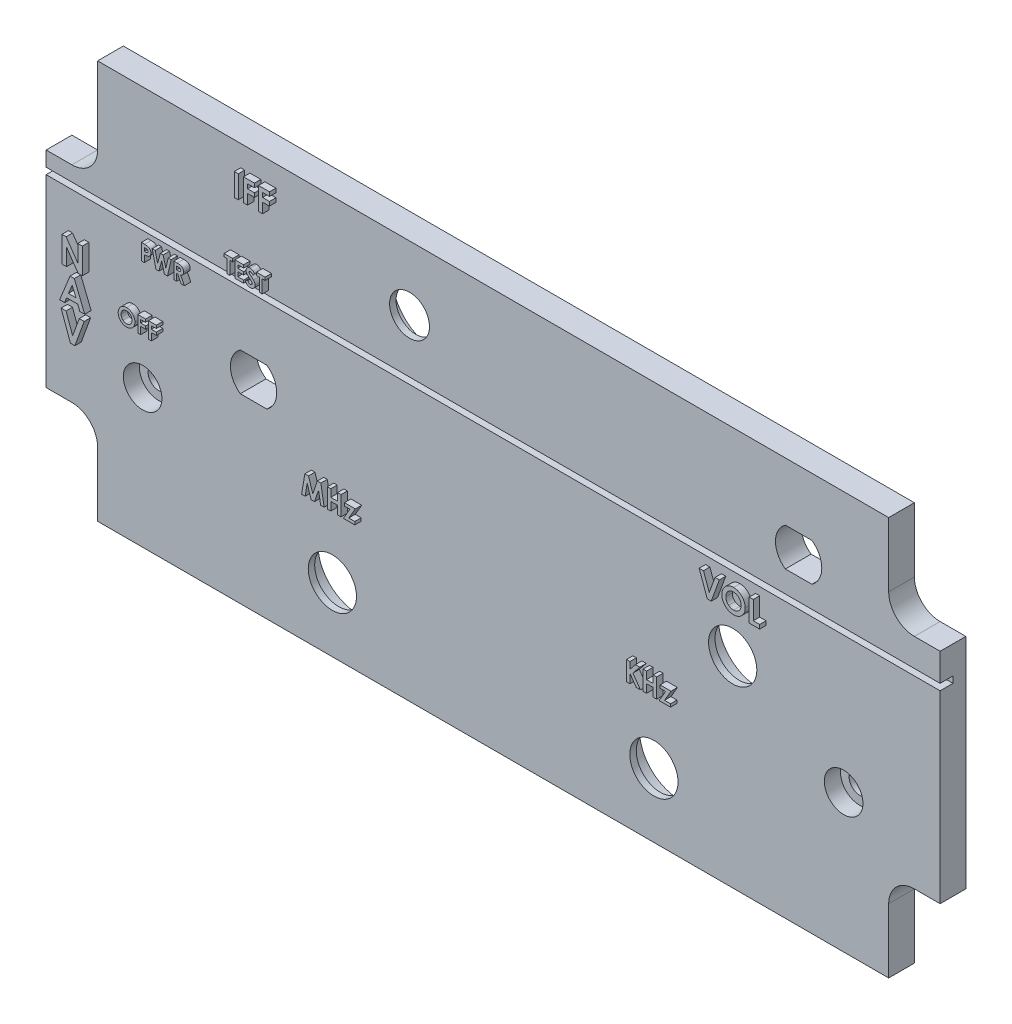
from build123d import *

# Parameters (mm, degrees)
SKETCH1_R           = 1.65
SKETCH1_R_2         = 3.75
SKETCH1_R_3         = 3.1
BOSS_EXTRUDE1_DEPTH = 4
SKETCH2_R           = 6.25
SKETCH2_R_2         = 3.75
SKETCH2_R_3         = 6.75
SKETCH2_R_4         = 3.1
BACK_HOLES_DEPTH    = 3
SKETCH3_R           = 3
CUT_EXTRUDE2_DEPTH  = 2.5
SKETCH5_W           = 139
SKETCH5_H           = 1
CUT_EXTRUDE3_DEPTH  = 2
SKETCH4_W           = 0.628205128
SKETCH4_H           = 3.5
TEXTOS_DEPTH        = 1


with BuildPart() as part:
    # Sketch1 → Boss-Extrude1 (new body)
    with BuildSketch(Plane.XY):
        with BuildLine():
            Line((8, 0), (131, 0))
            Line((131, 0), (131, 10))
            ThreePointArc((131, 10), (132.171572875, 12.828427125), (135, 14))
            Line((135, 14), (139, 14))
            Line((139, 14), (139, 48))
            Line((139, 48), (135, 48))
            ThreePointArc((135, 48), (132.171572875, 49.171572875), (131, 52))
            Line((131, 52), (131, 62))
            Line((131, 62), (8, 62))
            Line((8, 62), (8, 50))
            ThreePointArc((8, 50), (6.828427125, 47.171572875), (4, 46))
            Line((4, 46), (0, 46))
            Line((0, 46), (0, 14))
            Line((0, 14), (4, 14))
            ThreePointArc((4, 14), (6.828427125, 12.828427125), (8, 10))
            Line((8, 10), (8, 0))
        make_face()
        with Locations((15, 21.5)):
            Circle(SKETCH1_R, mode=Mode.SUBTRACT)
        with Locations((124, 21.5)):
            Circle(SKETCH1_R, mode=Mode.SUBTRACT)
        with Locations((106.75, 31.217622393)):
            Circle(SKETCH1_R_2, mode=Mode.SUBTRACT)
        with Locations((94.5, 10)):
            Circle(SKETCH1_R_2, mode=Mode.SUBTRACT)
        with Locations((44.5, 10)):
            Circle(SKETCH1_R_2, mode=Mode.SUBTRACT)
        with Locations((56.5, 52)):
            Circle(SKETCH1_R_3, mode=Mode.SUBTRACT)
        with BuildLine():
            Line((30.186628972, 28.267622393), (34.313371028, 28.267622393))
            ThreePointArc((34.313371028, 28.267622393), (35.85, 31.217622393), (34.313371028, 34.167622393))
            Line((34.313371028, 34.167622393), (30.186628972, 34.167622393))
            ThreePointArc((30.186628972, 34.167622393), (28.65, 31.217622393), (30.186628972, 28.267622393))
        make_face(mode=Mode.SUBTRACT)
        with BuildLine():
            Line((114.936628972, 47.05), (119.063371028, 47.05))
            ThreePointArc((119.063371028, 47.05), (120.6, 50), (119.063371028, 52.95))
            Line((119.063371028, 52.95), (114.936628972, 52.95))
            ThreePointArc((114.936628972, 52.95), (113.4, 50), (114.936628972, 47.05))
        make_face(mode=Mode.SUBTRACT)
    extrude(amount=BOSS_EXTRUDE1_DEPTH)

    # Sketch2 → Back holes (cut)
    # profile 1 of 4: a face of its own
    with BuildSketch(Plane(origin=(0, 0, 0), x_dir=(-1, 0, 0), z_dir=(0, 0, -1))):
        with Locations((-44.5, 10)):
            Circle(SKETCH2_R)
        with Locations((-44.5, 10)):
            Circle(SKETCH2_R_2, mode=Mode.SUBTRACT)
    # profile 2 of 4: a face of its own
    with BuildSketch(Plane(origin=(0, 0, 0), x_dir=(-1, 0, 0), z_dir=(0, 0, -1))):
        with Locations((-94.5, 10)):
            Circle(SKETCH2_R)
        with Locations((-94.5, 10)):
            Circle(SKETCH2_R_2, mode=Mode.SUBTRACT)
    # profile 3 of 4: a face of its own
    with BuildSketch(Plane(origin=(0, 0, 0), x_dir=(-1, 0, 0), z_dir=(0, 0, -1))):
        with Locations((-106.75, 31.217622393)):
            Circle(SKETCH2_R)
        with Locations((-106.75, 31.217622393)):
            Circle(SKETCH2_R_2, mode=Mode.SUBTRACT)
    # profile 4 of 4: a face of its own
    with BuildSketch(Plane(origin=(0, 0, 0), x_dir=(-1, 0, 0), z_dir=(0, 0, -1))):
        with Locations((-56.5, 52)):
            Circle(SKETCH2_R_3)
        with Locations((-56.5, 52)):
            Circle(SKETCH2_R_4, mode=Mode.SUBTRACT)
    extrude(amount=-BACK_HOLES_DEPTH, mode=Mode.SUBTRACT)

    # Sketch3 → Cut-Extrude2 (cut)
    with BuildSketch(Plane.XY.offset(4)):
        with Locations((15, 21.5)):
            Circle(SKETCH3_R)
        with Locations((124, 21.5)):
            Circle(SKETCH3_R)
    extrude(amount=-CUT_EXTRUDE2_DEPTH, mode=Mode.SUBTRACT)

    # Sketch5 → Cut-Extrude3 (cut)
    with BuildSketch(Plane.XY.offset(4)):
        with Locations((69.5, 43.174651963)):
            Rectangle(SKETCH5_W, SKETCH5_H)
    extrude(amount=-CUT_EXTRUDE3_DEPTH, mode=Mode.SUBTRACT)

    # Sketch4 → Textos (add)
    # profile 1 of 25: a face of its own
    with BuildSketch(Plane.XY.offset(4)):
        Polygon((3.456317208, 36.872484532), (4.102951824, 36.872484532), (5.91785567, 34.240272994), (5.91785567, 36.872484532), (6.635804388, 36.872484532), (6.635804388, 32.872484532), (5.98436208, 32.872484532), (4.174265926, 35.49668325), (4.174265926, 32.872484532), (3.456317208, 32.872484532), align=None)
    # profile 2 of 25: a face of its own
    with BuildSketch(Plane.XY.offset(4)):
        with BuildLine():
            add(Edge.make_bspline(
                [(13.505282568, 32.032467925), (13.548748132, 32.031342524), (13.634559, 32.029120727), (13.760755821, 32.010600314), (13.882369792, 31.980423958), (13.999345918, 31.938476639), (14.111391307, 31.883622212), (14.218901178, 31.817415836), (14.321490437, 31.738607905), (14.418107832, 31.649036877), (14.50739973, 31.551632296), (14.584771211, 31.446758948), (14.650750772, 31.337134205), (14.705434809, 31.222464326), (14.747086881, 31.101955167), (14.776315863, 30.976221165), (14.795094036, 30.845298091), (14.797253815, 30.756157323), (14.798351479, 30.710853342)],
                knots=[0, 0, 0, 0, 1.014329547, 2.002516266, 2.970391464, 3.935626869, 4.897733899, 5.877609409, 6.878433252, 7.912639331, 8.949961323, 9.958554974, 10.949718813, 11.932905612, 12.9188844, 13.919928257, 14.942845884, 16, 16, 16, 16], degree=3))
            add(Edge.make_bspline(
                [(14.798351479, 30.710853342), (14.797182514, 30.666059832), (14.794879033, 30.577792784), (14.777082471, 30.448076218), (14.747361269, 30.323689089), (14.706415648, 30.204349845), (14.652723373, 30.090636525), (14.588030485, 29.981823084), (14.510629863, 29.878919337), (14.423344609, 29.781980506), (14.32725112, 29.693987717), (14.225472861, 29.616444223), (14.11847978, 29.550736793), (14.006428482, 29.496895523), (13.889078677, 29.455111296), (13.766720235, 29.425629488), (13.639360726, 29.407712798), (13.552750083, 29.405424363), (13.508788177, 29.404262797)],
                knots=[0, 0, 0, 0, 1.051557043, 2.072126891, 3.067553643, 4.050577992, 5.02905126, 6.015227836, 7.017913613, 8.04756643, 9.074058332, 10.072836633, 11.047628519, 12.017157415, 12.98668631, 13.966869689, 14.968021931, 16, 16, 16, 16], degree=3))
            add(Edge.make_bspline(
                [(13.508788177, 29.404262797), (13.462809295, 29.405304779), (13.372467076, 29.407352131), (13.240250834, 29.426821516), (13.11357625, 29.456149212), (12.993507463, 29.499919224), (12.878821675, 29.554635419), (12.770361516, 29.622021694), (12.668163437, 29.701966688), (12.572813661, 29.792422979), (12.486426534, 29.891402002), (12.410172949, 29.995964563), (12.345851359, 30.105311894), (12.293459409, 30.219495175), (12.252155701, 30.337804782), (12.223020628, 30.460961255), (12.205809845, 30.588669222), (12.203412483, 30.675411026), (12.202197633, 30.719366963)],
                knots=[0, 0, 0, 0, 1.067978421, 2.098431617, 3.099715153, 4.085208694, 5.062210972, 6.048429807, 7.046490867, 8.072918869, 9.098532598, 10.095778865, 11.076610158, 12.041847152, 13.011192615, 13.984257998, 14.978533688, 16, 16, 16, 16], degree=3))
            add(Edge.make_bspline(
                [(12.202197633, 30.719366963), (12.202578923, 30.748938217), (12.203336675, 30.807706285), (12.212464595, 30.894797562), (12.225606177, 30.980188934), (12.245041952, 31.063539945), (12.268651452, 31.145438597), (12.299240894, 31.225122557), (12.334059957, 31.303443069), (12.374742754, 31.37947507), (12.419978091, 31.452519002), (12.46933387, 31.522230303), (12.522934198, 31.587766063), (12.580606408, 31.649556956), (12.642549247, 31.707196824), (12.707947922, 31.761501641), (12.778070786, 31.811028879), (12.851383068, 31.85698809), (12.927471453, 31.898548207), (13.00602619, 31.933922936), (13.085428897, 31.964815084), (13.166740287, 31.989196534), (13.249088964, 32.009054969), (13.333354657, 32.022187693), (13.418776072, 32.031315361), (13.476378637, 32.032082825), (13.505282568, 32.032467925)],
                knots=[0, 0, 0, 0, 1.034744296, 2.056386356, 3.06226378, 4.057406941, 5.050368692, 6.043467995, 7.042652155, 8.049140477, 9.059438543, 10.048523776, 11.036952808, 12.020949711, 13.004946614, 13.997082645, 14.994316842, 16.007702937, 17.024872941, 18.026463647, 19.021641123, 20.005082605, 20.995858141, 21.984425357, 22.988620895, 24, 24, 24, 24], degree=3))
        make_face()
        with BuildLine():
            add(Edge.make_bspline(
                [(13.49827135, 31.583749976), (13.469019032, 31.582965071), (13.41128666, 31.581415982), (13.326603785, 31.569614018), (13.245305235, 31.550764939), (13.167841678, 31.52346228), (13.093877383, 31.488712924), (13.023281232, 31.44663829), (12.957030837, 31.395792109), (12.894242813, 31.338904086), (12.837524165, 31.275517755), (12.78741145, 31.207588522), (12.745475179, 31.135229826), (12.710353289, 31.059113864), (12.68391429, 30.978384731), (12.665082584, 30.893674787), (12.653181649, 30.804838074), (12.651681521, 30.744278202), (12.650915581, 30.713357348)],
                knots=[0, 0, 0, 0, 1.033739768, 2.040188636, 3.016340934, 3.979330865, 4.937572243, 5.900995986, 6.878200029, 7.884839167, 8.891893314, 9.879764717, 10.863503415, 11.843163062, 12.837761627, 13.859916423, 14.907309254, 16, 16, 16, 16], degree=3))
            add(Edge.make_bspline(
                [(12.650915581, 30.713357348), (12.651931101, 30.679090086), (12.653921351, 30.611931931), (12.667924992, 30.513963424), (12.691883827, 30.421441892), (12.72647992, 30.334819845), (12.769388152, 30.253135409), (12.822673366, 30.177389744), (12.885472594, 30.10712932), (12.93385261, 30.066108357), (12.958407568, 30.045288438)],
                knots=[0, 0, 0, 0, 1.078454662, 2.113592447, 3.107694534, 4.079536787, 5.043276885, 6.005368276, 6.987637804, 8, 8, 8, 8], degree=3))
            add(Edge.make_bspline(
                [(12.958407568, 30.045288438), (12.978522767, 30.029907481), (13.018299966, 29.999492103), (13.081793036, 29.960508557), (13.147178396, 29.927095769), (13.21494946, 29.900098631), (13.284963099, 29.878863137), (13.357209712, 29.863992269), (13.431586932, 29.854659513), (13.481884294, 29.853544072), (13.507285774, 29.852980745)],
                knots=[0, 0, 0, 0, 1.023928204, 2.024787132, 3.009472467, 3.9914905, 4.972207045, 5.96565515, 6.972602802, 8, 8, 8, 8], degree=3))
            add(Edge.make_bspline(
                [(13.507285774, 29.852980745), (13.536035098, 29.853772306), (13.592600298, 29.855329726), (13.675706756, 29.866986402), (13.755325266, 29.886713705), (13.831950108, 29.913776856), (13.905360329, 29.94896252), (13.975197155, 29.992342178), (14.041583027, 30.043383182), (14.10429106, 30.101018269), (14.161609167, 30.164654298), (14.211617307, 30.232945859), (14.254886942, 30.304388285), (14.289278471, 30.379992734), (14.316762015, 30.459045536), (14.335367071, 30.541896798), (14.347368543, 30.628204977), (14.348869093, 30.686940743), (14.34963353, 30.716862957)],
                knots=[0, 0, 0, 0, 1.026359118, 2.019393844, 2.989460624, 3.950973911, 4.916101784, 5.890408035, 6.881132271, 7.902007068, 8.92769091, 9.933912415, 10.920395702, 11.90457117, 12.894218921, 13.903490204, 14.931958862, 16, 16, 16, 16], degree=3))
            add(Edge.make_bspline(
                [(14.34963353, 30.716862957), (14.348842643, 30.74661311), (14.347285904, 30.805171748), (14.335608712, 30.89125803), (14.316006514, 30.973743528), (14.288862095, 31.052762952), (14.25420011, 31.128393769), (14.211337049, 31.200370016), (14.160423313, 31.26862211), (14.102630679, 31.332684939), (14.039726949, 31.391554576), (13.972193509, 31.442642719), (13.901920022, 31.487036692), (13.827294069, 31.521813137), (13.749842437, 31.549519457), (13.66909251, 31.569922789), (13.584738444, 31.581333072), (13.527350629, 31.58293716), (13.49827135, 31.583749976)],
                knots=[0, 0, 0, 0, 1.055025985, 2.07665775, 3.074803781, 4.057872707, 5.035505728, 6.020516407, 7.023567878, 8.050795229, 9.077271434, 10.074415901, 11.050397877, 12.019801805, 12.988065821, 13.964604439, 14.968634123, 16, 16, 16, 16], degree=3))
        make_face(mode=Mode.SUBTRACT)
    # profile 3 of 25: a face of its own
    with BuildSketch(Plane.XY.offset(4)):
        Polygon((15.247069427, 31.968365361), (16.465018145, 31.968365361), (16.465018145, 31.519647412), (15.695787376, 31.519647412), (15.695787376, 31.038878181), (16.465018145, 31.038878181), (16.465018145, 30.590160233), (15.695787376, 30.590160233), (15.695787376, 29.468365361), (15.247069427, 29.468365361), align=None)
    # profile 4 of 25: a face of its own
    with BuildSketch(Plane.XY.offset(4)):
        Polygon((16.913736094, 31.968365361), (18.131684812, 31.968365361), (18.131684812, 31.519647412), (17.362454043, 31.519647412), (17.362454043, 31.038878181), (18.131684812, 31.038878181), (18.131684812, 30.590160233), (17.362454043, 30.590160233), (17.362454043, 29.468365361), (16.913736094, 29.468365361), align=None)
    # profile 5 of 25: a face of its own
    with BuildSketch(Plane.XY.offset(4)):
        with BuildLine():
            Line((15.809110504, 41.959185567), (16.309911786, 41.959185567))
            add(Edge.make_bspline(
                [(16.309911786, 41.959185567), (16.342633492, 41.959039097), (16.405760522, 41.958756527), (16.496794893, 41.95532999), (16.580778558, 41.949189426), (16.657692221, 41.941600661), (16.727504257, 41.930961506), (16.790302092, 41.918764549), (16.846098759, 41.903905105), (16.895523446, 41.886267152), (16.939880507, 41.865472693), (16.981856593, 41.84332511), (17.020503041, 41.816892752), (17.057770452, 41.789024384), (17.091528184, 41.757057754), (17.123882248, 41.723120286), (17.153462361, 41.685866048), (17.180405585, 41.645745993), (17.204847241, 41.603501368), (17.226201107, 41.559056652), (17.243522167, 41.512341517), (17.258052382, 41.463658155), (17.269723193, 41.413008689), (17.277491656, 41.360081619), (17.282768387, 41.305246504), (17.283233985, 41.267925689), (17.283469479, 41.249049349)],
                knots=[0, 0, 0, 0, 1.698747864, 3.27724071, 4.728299578, 6.070144658, 7.288476769, 8.393259625, 9.389771311, 10.283485332, 11.113357557, 11.931608583, 12.74405601, 13.541433047, 14.344816069, 15.154114104, 15.974336324, 16.810834471, 17.661136416, 18.50621059, 19.367396281, 20.244825668, 21.142564693, 22.063065223, 23.020325768, 24, 24, 24, 24], degree=3))
            add(Edge.make_bspline(
                [(17.283469479, 41.249049349), (17.28312875, 41.228166903), (17.282459175, 41.187130331), (17.275895185, 41.12697575), (17.264681815, 41.069623804), (17.250026528, 41.014590833), (17.229590773, 40.962782251), (17.206243882, 40.91296189), (17.177519801, 40.86652656), (17.144697946, 40.822895411), (17.108852736, 40.7817137), (17.069133207, 40.744170473), (17.02629643, 40.710009797), (16.980590373, 40.678873667), (16.931843441, 40.650824891), (16.880090807, 40.625600822), (16.824979075, 40.604008204), (16.786600923, 40.592715439), (16.767143357, 40.586990054)],
                knots=[0, 0, 0, 0, 1.102006807, 2.165578795, 3.188629044, 4.184801286, 5.166646146, 6.124351954, 7.085497154, 8.042432466, 9.003981491, 9.963833307, 10.922997304, 11.89326795, 12.880200226, 13.889073926, 14.929769137, 16, 16, 16, 16], degree=3))
            add(Edge.make_bspline(
                [(16.767143357, 40.586990054), (16.754327485, 40.583801444), (16.726564179, 40.576893889), (16.680623533, 40.569880986), (16.627681763, 40.563433054), (16.567567672, 40.557891836), (16.500246604, 40.554125099), (16.425783742, 40.551183445), (16.344145342, 40.549044559), (16.287377227, 40.548968662), (16.257828453, 40.548929157)],
                knots=[0, 0, 0, 0, 0.618981996, 1.340914327, 2.176866532, 3.120127938, 4.170906482, 5.338178032, 6.614476169, 8, 8, 8, 8], degree=3))
            Line((16.257828453, 40.548929157), (16.257828453, 39.459185567))
            Line((16.257828453, 39.459185567), (15.809110504, 39.459185567))
            Line((15.809110504, 39.459185567), (15.809110504, 41.959185567))
        make_face()
        with BuildLine():
            Line((16.257828453, 40.997647105), (16.416582459, 40.997647105))
            add(Edge.make_bspline(
                [(16.416582459, 40.997647105), (16.445470257, 40.997830276), (16.498624234, 40.998167314), (16.571213797, 41.003041072), (16.629548166, 41.010484284), (16.6756334, 41.021159572), (16.712022058, 41.037360736), (16.743404997, 41.056102431), (16.770322945, 41.07980079), (16.793629926, 41.10688022), (16.812263155, 41.137995842), (16.825184329, 41.172640999), (16.833577669, 41.210087759), (16.834352872, 41.236148226), (16.83475153, 41.24955015)],
                knots=[0, 0, 0, 0, 1.8619151, 3.425951444, 4.686033666, 5.651700536, 6.461346321, 7.243864085, 7.999046032, 8.762387399, 9.539336099, 10.322741239, 11.137448474, 12, 12, 12, 12], degree=3))
            add(Edge.make_bspline(
                [(16.83475153, 41.24955015), (16.834356973, 41.261259237), (16.833591437, 41.283977681), (16.827967603, 41.31676603), (16.819004829, 41.347331536), (16.806018113, 41.375354981), (16.789229366, 41.40078875), (16.768760485, 41.423622824), (16.744874127, 41.444346212), (16.726432462, 41.455315419), (16.717063229, 41.460888291)],
                knots=[0, 0, 0, 0, 1.102301479, 2.1387299, 3.123554645, 4.094223062, 5.036071848, 5.982632524, 6.975082478, 8, 8, 8, 8], degree=3))
            add(Edge.make_bspline(
                [(16.717063229, 41.460888291), (16.709126948, 41.464901896), (16.692324214, 41.47339952), (16.66370753, 41.483278629), (16.630684314, 41.491612746), (16.593031622, 41.498529983), (16.55089966, 41.503898477), (16.504295947, 41.508004032), (16.4531519, 41.509655035), (16.417584276, 41.510189286), (16.399054415, 41.510467618)],
                knots=[0, 0, 0, 0, 0.656809284, 1.390599849, 2.23162475, 3.173112763, 4.218524733, 5.370385145, 6.63003504, 8, 8, 8, 8], degree=3))
            Line((16.399054415, 41.510467618), (16.257828453, 41.510467618))
            Line((16.257828453, 41.510467618), (16.257828453, 40.997647105))
        make_face(mode=Mode.SUBTRACT)
    # profile 6 of 25: a face of its own
    with BuildSketch(Plane.XY.offset(4)):
        Polygon((17.491802812, 41.959185567), (17.955043998, 41.959185567), (18.325136145, 40.363131881), (18.749314831, 41.959185567), (19.184511145, 41.959185567), (19.607187427, 40.363131881), (19.97527637, 41.959185567), (20.440520761, 41.959185567), (19.862596081, 39.459185567), (19.393846081, 39.459185567), (18.966161786, 41.075271304), (18.536474286, 39.459185567), (18.071229895, 39.459185567), align=None)
    # profile 7 of 25: a face of its own
    with BuildSketch(Plane.XY.offset(4)):
        with BuildLine():
            Line((20.841161786, 41.959185567), (21.363998325, 41.959185567))
            add(Edge.make_bspline(
                [(21.363998325, 41.959185567), (21.398557661, 41.959062901), (21.465024999, 41.95882698), (21.56086727, 41.955104773), (21.648911577, 41.949925017), (21.729288276, 41.942020571), (21.801962982, 41.931540231), (21.867008531, 41.919185645), (21.924423023, 41.905104945), (21.974690669, 41.887559282), (22.020054733, 41.867768041), (22.062340348, 41.845027541), (22.102480397, 41.819591006), (22.140206588, 41.790789132), (22.175846768, 41.759140057), (22.209468177, 41.724611923), (22.240595712, 41.686911947), (22.26903663, 41.646278343), (22.294958237, 41.603532724), (22.317867502, 41.558616399), (22.336497353, 41.511498133), (22.352958825, 41.462858885), (22.364815489, 41.412003348), (22.373061626, 41.35942661), (22.379099124, 41.304943595), (22.379446251, 41.267930254), (22.379623325, 41.249049349)],
                knots=[0, 0, 0, 0, 1.749336639, 3.364467119, 4.854658419, 6.213483162, 7.451590619, 8.570285859, 9.5643256, 10.440900261, 11.26203566, 12.067320669, 12.869050712, 13.665104639, 14.467235401, 15.27997916, 16.102287765, 16.939272006, 17.78853747, 18.631303466, 19.488103222, 20.351255419, 21.228522269, 22.127379805, 23.044756219, 24, 24, 24, 24], degree=3))
            add(Edge.make_bspline(
                [(22.379623325, 41.249049349), (22.379163352, 41.229342021), (22.378261429, 41.190699544), (22.37340318, 41.133936896), (22.364523827, 41.079630365), (22.351074755, 41.027938953), (22.335616794, 40.978219302), (22.315061671, 40.931388768), (22.291863182, 40.886766271), (22.264311016, 40.844983012), (22.234073859, 40.805110902), (22.198908682, 40.768677589), (22.161093647, 40.73372492), (22.118503035, 40.702442212), (22.073014278, 40.672714242), (22.023723564, 40.645772783), (21.970952579, 40.620940591), (21.933851964, 40.607092446), (21.914879735, 40.600010887)],
                knots=[0, 0, 0, 0, 1.099860209, 2.156625411, 3.176576793, 4.16617041, 5.135385252, 6.078461593, 7.016046972, 7.938469504, 8.868247731, 9.803980173, 10.76021508, 11.73834243, 12.748633912, 13.790971185, 14.870363756, 16, 16, 16, 16], degree=3))
            Line((21.914879735, 40.600010887), (22.491802812, 39.459185567))
            Line((22.491802812, 39.459185567), (21.993004735, 39.459185567))
            Line((21.993004735, 39.459185567), (21.442123325, 40.548929157))
            Line((21.442123325, 40.548929157), (21.289879735, 40.548929157))
            Line((21.289879735, 40.548929157), (21.289879735, 39.459185567))
            Line((21.289879735, 39.459185567), (20.841161786, 39.459185567))
            Line((20.841161786, 39.459185567), (20.841161786, 41.959185567))
        make_face()
        with BuildLine():
            Line((21.289879735, 40.997647105), (21.464659383, 40.997647105))
            add(Edge.make_bspline(
                [(21.464659383, 40.997647105), (21.486027647, 40.997887769), (21.526943283, 40.998348588), (21.585785341, 41.00048606), (21.639227962, 41.005636309), (21.687500648, 41.012143457), (21.730846302, 41.0196569), (21.768878297, 41.030424118), (21.802182647, 41.041961466), (21.830364694, 41.056299396), (21.854442787, 41.072604732), (21.87523268, 41.091127999), (21.892428902, 41.112566322), (21.90658227, 41.1363371), (21.917592051, 41.16265058), (21.925628348, 41.191217899), (21.93011945, 41.222364475), (21.930636166, 41.243859854), (21.930905376, 41.255058964)],
                knots=[0, 0, 0, 0, 1.688639943, 3.233382647, 4.650958383, 5.928841754, 7.082724185, 8.122798841, 9.049171256, 9.863274652, 10.613301712, 11.341792392, 12.054588806, 12.776240173, 13.521029143, 14.301969904, 15.115324896, 16, 16, 16, 16], degree=3))
            add(Edge.make_bspline(
                [(21.930905376, 41.255058964), (21.93039641, 41.268308329), (21.929396642, 41.294334252), (21.919475829, 41.331802454), (21.903684039, 41.366481839), (21.882037819, 41.398215717), (21.85477722, 41.426035824), (21.823493532, 41.450559471), (21.787511576, 41.469950935), (21.754194994, 41.482741339), (21.723884691, 41.490393969), (21.696530599, 41.496096642), (21.664854395, 41.500138289), (21.628832167, 41.504425176), (21.588555736, 41.507205005), (21.54380557, 41.509233726), (21.494710194, 41.510063776), (21.460486053, 41.510329128), (21.442624126, 41.510467618)],
                knots=[0, 0, 0, 0, 1.020303359, 2.004196876, 2.966617323, 3.9489082, 4.950758222, 5.960522915, 7.003732012, 8.091992268, 8.70421221, 9.413913587, 10.24622431, 11.166358409, 12.212345909, 13.359657661, 14.621978493, 16, 16, 16, 16], degree=3))
            Line((21.442624126, 41.510467618), (21.289879735, 41.510467618))
            Line((21.289879735, 41.510467618), (21.289879735, 40.997647105))
        make_face(mode=Mode.SUBTRACT)
    # profile 8 of 25: a face of its own
    with BuildSketch(Plane.XY.offset(4)):
        Polygon((28.65495004, 46.89105195), (30.001103887, 46.89105195), (30.001103887, 46.442334002), (29.552385938, 46.442334002), (29.552385938, 44.39105195), (29.103667989, 44.39105195), (29.103667989, 46.442334002), (28.65495004, 46.442334002), align=None)
    # profile 9 of 25: a face of its own
    with BuildSketch(Plane.XY.offset(4)):
        Polygon((30.353667989, 46.89105195), (31.699821835, 46.89105195), (31.699821835, 46.442334002), (30.802385938, 46.442334002), (30.802385938, 45.961564771), (31.699821835, 45.961564771), (31.699821835, 45.512846822), (30.802385938, 45.512846822), (30.802385938, 44.839769899), (31.699821835, 44.839769899), (31.699821835, 44.39105195), (30.353667989, 44.39105195), align=None)
    # profile 10 of 25: a face of its own
    with BuildSketch(Plane.XY.offset(4)):
        with BuildLine():
            Line((33.430591066, 46.557017495), (33.095054207, 46.250026309))
            add(Edge.make_bspline(
                [(33.095054207, 46.250026309), (33.080681247, 46.270300864), (33.053087167, 46.309225182), (33.008360043, 46.36134576), (32.963834884, 46.405808493), (32.919099193, 46.442427634), (32.873756449, 46.470980696), (32.827885361, 46.491196579), (32.781745984, 46.504048008), (32.750747445, 46.50564832), (32.735478887, 46.506436566)],
                knots=[0, 0, 0, 0, 1.299362458, 2.494594718, 3.587462134, 4.587049575, 5.512617175, 6.380583204, 7.202344345, 8, 8, 8, 8], degree=3))
            add(Edge.make_bspline(
                [(32.735478887, 46.506436566), (32.721236813, 46.505937097), (32.693739112, 46.504972755), (32.654539098, 46.495387263), (32.619736767, 46.478844111), (32.589366086, 46.457212548), (32.565308025, 46.431151531), (32.546099529, 46.403820224), (32.535283532, 46.373652642), (32.533859934, 46.35293233), (32.533155169, 46.342674546)],
                knots=[0, 0, 0, 0, 1.185010067, 2.2879431, 3.333075148, 4.379039566, 5.372662701, 6.27520591, 7.14612461, 8, 8, 8, 8], degree=3))
            add(Edge.make_bspline(
                [(32.533155169, 46.342674546), (32.533596809, 46.332268841), (32.534486213, 46.311313196), (32.543076637, 46.28060009), (32.556024859, 46.250589809), (32.568397414, 46.232321123), (32.574721675, 46.22298304)],
                knots=[0, 0, 0, 0, 0.967525499, 1.948461899, 2.951351359, 4, 4, 4, 4], degree=3))
            add(Edge.make_bspline(
                [(32.574721675, 46.22298304), (32.580471113, 46.215724646), (32.593705559, 46.199016781), (32.618940937, 46.172554128), (32.650631271, 46.140135062), (32.689996074, 46.10287438), (32.735401203, 46.05943204), (32.788951245, 46.01151578), (32.849104796, 45.957641687), (32.891860546, 45.920125719), (32.914264944, 45.900467014)],
                knots=[0, 0, 0, 0, 0.473873513, 1.090794244, 1.870441696, 2.795289791, 3.865433203, 5.087734844, 6.473946851, 8, 8, 8, 8], degree=3))
            add(Edge.make_bspline(
                [(32.914264944, 45.900467014), (32.935294695, 45.882266826), (32.975204792, 45.84772665), (33.031988934, 45.798702416), (33.081892738, 45.754596508), (33.125643189, 45.716070862), (33.16257707, 45.682721254), (33.192849654, 45.654388275), (33.216830669, 45.631623515), (33.230462471, 45.617873587), (33.236280169, 45.612005476)],
                knots=[0, 0, 0, 0, 1.543621617, 2.929473131, 4.163658386, 5.240097082, 6.164993805, 6.925417477, 7.541396219, 8, 8, 8, 8], degree=3))
            add(Edge.make_bspline(
                [(33.236280169, 45.612005476), (33.2583513, 45.588119784), (33.300779767, 45.542203097), (33.355921816, 45.471046672), (33.401305506, 45.401583492), (33.436415189, 45.332506495), (33.462931434, 45.262819037), (33.481625738, 45.190812037), (33.492821881, 45.115733067), (33.494064914, 45.064500835), (33.49469363, 45.038588008)],
                knots=[0, 0, 0, 0, 1.206664779, 2.319633467, 3.337109185, 4.282041471, 5.190008762, 6.099243693, 7.03861361, 8, 8, 8, 8], degree=3))
            add(Edge.make_bspline(
                [(33.49469363, 45.038588008), (33.494246126, 45.013339136), (33.493368107, 44.963799908), (33.482614059, 44.891306628), (33.467279417, 44.821927412), (33.443569371, 44.756417206), (33.414671707, 44.693700678), (33.378444312, 44.634754752), (33.335900203, 44.578982873), (33.287138123, 44.52738203), (33.233201471, 44.480557842), (33.175349287, 44.438873843), (33.113015861, 44.404458393), (33.046733761, 44.376119724), (32.976538467, 44.354292903), (32.902513601, 44.338160848), (32.824545938, 44.328478643), (32.771230527, 44.327466483), (32.743992508, 44.326949386)],
                knots=[0, 0, 0, 0, 1.043214005, 2.046824704, 3.02475056, 3.976699089, 4.921714032, 5.875962561, 6.831408892, 7.817874052, 8.806269674, 9.781291748, 10.760897367, 11.74438705, 12.757449933, 13.795994037, 14.874007457, 16, 16, 16, 16], degree=3))
            add(Edge.make_bspline(
                [(32.743992508, 44.326949386), (32.722610896, 44.32732871), (32.68026304, 44.328079989), (32.617848703, 44.334213558), (32.557580606, 44.344112486), (32.499526634, 44.358300607), (32.443425244, 44.37627888), (32.389274133, 44.398238653), (32.337447123, 44.424520292), (32.287552066, 44.454583343), (32.239831515, 44.489490505), (32.193682062, 44.528528114), (32.149562106, 44.572296584), (32.107259749, 44.620692404), (32.067045652, 44.673852622), (32.027603465, 44.73103688), (31.990686117, 44.793306443), (31.967880629, 44.836989046), (31.956232092, 44.859301149)],
                knots=[0, 0, 0, 0, 1.016823716, 2.013894106, 2.979844003, 3.91962641, 4.853723003, 5.779685073, 6.695824784, 7.614987388, 8.547259901, 9.504950863, 10.487499108, 11.500346958, 12.559593716, 13.656357062, 14.802919212, 16, 16, 16, 16], degree=3))
            Line((31.956232092, 44.859301149), (32.350863502, 45.096180155))
            add(Edge.make_bspline(
                [(32.350863502, 45.096180155), (32.365434081, 45.070853003), (32.393367126, 45.022298686), (32.440702283, 44.957059808), (32.489194734, 44.901193509), (32.539965582, 44.855687227), (32.592397473, 44.819932487), (32.646743664, 44.794379668), (32.703042338, 44.778562503), (32.741390438, 44.776630862), (32.760518951, 44.775667335)],
                knots=[0, 0, 0, 0, 1.283663364, 2.460892379, 3.537111102, 4.529833553, 5.449777664, 6.316464042, 7.160231139, 8, 8, 8, 8], degree=3))
            add(Edge.make_bspline(
                [(32.760518951, 44.775667335), (32.779975387, 44.776454203), (32.817723707, 44.777980842), (32.871604604, 44.792081947), (32.92100465, 44.814221717), (32.963705685, 44.845812115), (32.99986223, 44.882272236), (33.026547835, 44.922835787), (33.043311912, 44.96672457), (33.045084281, 44.997212606), (33.045975681, 45.012546341)],
                knots=[0, 0, 0, 0, 1.13588714, 2.203786484, 3.234766741, 4.283437687, 5.291419208, 6.222934724, 7.106237994, 8, 8, 8, 8], degree=3))
            add(Edge.make_bspline(
                [(33.045975681, 45.012546341), (33.04515251, 45.026811887), (33.043480315, 45.055790976), (33.031163447, 45.098878222), (33.011908425, 45.141945873), (32.989128376, 45.177271125), (32.965946823, 45.206848002), (32.943780031, 45.232475027), (32.916786741, 45.260788403), (32.885035397, 45.291823747), (32.848945518, 45.32585427), (32.808486702, 45.36287664), (32.763195652, 45.402564734), (32.731183849, 45.429599872), (32.714445233, 45.443736245)],
                knots=[0, 0, 0, 0, 0.916159276, 1.861089862, 2.860218735, 3.940849679, 4.552606315, 5.27541173, 6.11797699, 7.06649574, 8.129236253, 9.306560635, 10.591630461, 12, 12, 12, 12], degree=3))
            add(Edge.make_bspline(
                [(32.714445233, 45.443736245), (32.682624457, 45.470659673), (32.621550756, 45.52233388), (32.535245869, 45.598655057), (32.457477437, 45.669984191), (32.388917154, 45.737203064), (32.328691455, 45.799070301), (32.277208214, 45.856088411), (32.235032998, 45.90869721), (32.190652677, 45.971008812), (32.1484825, 46.04693978), (32.112035499, 46.138293538), (32.088390224, 46.229635704), (32.085741099, 46.290957803), (32.08443722, 46.321140091)],
                knots=[0, 0, 0, 0, 1.345494975, 2.582412109, 3.71882943, 4.751509156, 5.681369928, 6.505683931, 7.230279997, 7.856715994, 8.973648664, 10.023341002, 11.027102913, 12, 12, 12, 12], degree=3))
            add(Edge.make_bspline(
                [(32.08443722, 46.321140091), (32.084979502, 46.34254375), (32.086047855, 46.384711257), (32.095577732, 46.446712432), (32.109820495, 46.506538357), (32.130505077, 46.563970758), (32.157351167, 46.618937701), (32.1899547, 46.67170827), (32.228821948, 46.721796778), (32.272622713, 46.769170019), (32.320879941, 46.812463771), (32.372448921, 46.850674845), (32.42703777, 46.882948473), (32.484312539, 46.909721792), (32.544628137, 46.930215066), (32.607540222, 46.944741721), (32.673139029, 46.953381711), (32.717757921, 46.954556218), (32.740486899, 46.955154514)],
                knots=[0, 0, 0, 0, 1.010766082, 1.991317756, 2.957454644, 3.913069143, 4.869106762, 5.843196583, 6.838735724, 7.860187025, 8.887984031, 9.89767229, 10.887916223, 11.879572884, 12.879850636, 13.892031539, 14.926195476, 16, 16, 16, 16], degree=3))
            add(Edge.make_bspline(
                [(32.740486899, 46.955154514), (32.76994253, 46.954076965), (32.828621278, 46.951930371), (32.9153795, 46.93514471), (33.000121304, 46.908747491), (33.068407838, 46.876902149), (33.122742158, 46.846053552), (33.164384339, 46.817652049), (33.2067575, 46.785116602), (33.250203353, 46.748344682), (33.293914608, 46.706643457), (33.339134185, 46.661005659), (33.385245911, 46.61103687), (33.415211222, 46.575339398), (33.430591066, 46.557017495)],
                knots=[0, 0, 0, 0, 1.282922637, 2.555718331, 3.837320111, 5.142675274, 5.830281639, 6.55870424, 7.337177975, 8.157850921, 9.037902056, 9.96903443, 10.957596896, 12, 12, 12, 12], degree=3))
        make_face()
    # profile 11 of 25: a face of its own
    with BuildSketch(Plane.XY.offset(4)):
        Polygon((33.687001322, 46.89105195), (35.033155169, 46.89105195), (35.033155169, 46.442334002), (34.58443722, 46.442334002), (34.58443722, 44.39105195), (34.135719271, 44.39105195), (34.135719271, 46.442334002), (33.687001322, 46.442334002), align=None)
    # profile 12 of 25: a face of its own
    with BuildSketch(Plane.XY.offset(4)):
        Polygon((102.534407106, 41.447027702), (103.205380664, 41.447027702), (104.104919927, 38.960849818), (105.005160311, 41.447027702), (105.675432747, 41.447027702), (104.40710342, 37.947027702), (103.801334189, 37.947027702), align=None)
    # profile 13 of 25: a face of its own
    with BuildSketch(Plane.XY.offset(4)):
        with BuildLine():
            add(Edge.make_bspline(
                [(107.881161914, 41.536771292), (107.942013703, 41.53519573), (108.062148918, 41.532085214), (108.238824467, 41.506156637), (108.409084026, 41.463909738), (108.572850604, 41.405183492), (108.729714147, 41.328387294), (108.880227967, 41.235698367), (109.02385293, 41.125367264), (109.159117282, 40.999967825), (109.284125939, 40.863601412), (109.392446014, 40.716778724), (109.484817399, 40.563304084), (109.561375051, 40.402766254), (109.619687952, 40.234053431), (109.660608527, 40.058025829), (109.686897969, 39.874733525), (109.689921659, 39.749936449), (109.691458388, 39.686510875)],
                knots=[0, 0, 0, 0, 1.014329547, 2.002516266, 2.970391464, 3.935626869, 4.897733899, 5.877609409, 6.878433252, 7.912639331, 8.949961323, 9.958554974, 10.949718813, 11.932905612, 12.9188844, 13.919928257, 14.942845884, 16, 16, 16, 16], degree=3))
            add(Edge.make_bspline(
                [(109.691458388, 39.686510875), (109.689821838, 39.623799962), (109.686596964, 39.500226095), (109.661681777, 39.318622902), (109.620072095, 39.144480922), (109.562748226, 38.97740598), (109.487579041, 38.818207332), (109.397008998, 38.665868514), (109.288648126, 38.521803269), (109.166448771, 38.386088906), (109.031917887, 38.262899001), (108.889428324, 38.154338109), (108.73963801, 38.062347707), (108.582766193, 37.986969929), (108.418476466, 37.928472012), (108.247174647, 37.887197481), (108.068871334, 37.862114115), (107.947616435, 37.858910305), (107.886069766, 37.857284113)],
                knots=[0, 0, 0, 0, 1.051557043, 2.072126891, 3.067553643, 4.050577992, 5.02905126, 6.015227836, 7.017913613, 8.04756643, 9.074058332, 10.072836633, 11.047628519, 12.017157415, 12.98668631, 13.966869689, 14.968021931, 16, 16, 16, 16], degree=3))
            add(Edge.make_bspline(
                [(107.886069766, 37.857284113), (107.821699331, 37.858742887), (107.695220224, 37.861609181), (107.510117486, 37.88886632), (107.332773068, 37.929925093), (107.164676766, 37.99120311), (107.004116663, 38.067805784), (106.852272441, 38.162146569), (106.709195129, 38.27406956), (106.575705444, 38.400708368), (106.454763465, 38.539279), (106.348008447, 38.685666585), (106.25795822, 38.838752849), (106.184609491, 38.998609441), (106.1267843, 39.164242891), (106.085995197, 39.336661955), (106.061900101, 39.515453108), (106.058543794, 39.636891633), (106.056843004, 39.698429946)],
                knots=[0, 0, 0, 0, 1.067978421, 2.098431617, 3.099715153, 4.085208694, 5.062210972, 6.048429807, 7.046490867, 8.072918869, 9.098532598, 10.095778865, 11.076610158, 12.041847152, 13.011192615, 13.984257998, 14.978533688, 16, 16, 16, 16], degree=3))
            add(Edge.make_bspline(
                [(106.056843004, 39.698429946), (106.05737681, 39.739829701), (106.058437662, 39.822104997), (106.071216751, 39.944032784), (106.089614966, 40.063580705), (106.116825051, 40.18027212), (106.149878351, 40.294930233), (106.19270357, 40.406487777), (106.241450258, 40.516136494), (106.298406174, 40.622581295), (106.361735645, 40.7248428), (106.430833737, 40.822438622), (106.505874195, 40.914188686), (106.586615289, 41.000695935), (106.673335264, 41.081391751), (106.764893409, 41.157418495), (106.863065418, 41.226756627), (106.965702614, 41.291099523), (107.072226352, 41.349283687), (107.182202984, 41.398808308), (107.293366774, 41.442057315), (107.40720272, 41.476191344), (107.522490867, 41.503993154), (107.640462837, 41.522378968), (107.760052819, 41.535157703), (107.84069641, 41.536232153), (107.881161914, 41.536771292)],
                knots=[0, 0, 0, 0, 1.034744296, 2.056386356, 3.06226378, 4.057406941, 5.050368692, 6.043467995, 7.042652155, 8.049140477, 9.059438543, 10.048523776, 11.036952808, 12.020949711, 13.004946614, 13.997082645, 14.994316842, 16.007702937, 17.024872941, 18.026463647, 19.021641123, 20.005082605, 20.995858141, 21.984425357, 22.988620895, 24, 24, 24, 24], degree=3))
        make_face()
        with BuildLine():
            add(Edge.make_bspline(
                [(107.871346209, 40.908566164), (107.830392962, 40.907467296), (107.749567642, 40.905298572), (107.631011617, 40.888775822), (107.517193646, 40.862387112), (107.408744668, 40.824163389), (107.305194654, 40.77551429), (107.206360043, 40.716609803), (107.11360949, 40.64542515), (107.025706256, 40.565781918), (106.946300148, 40.477041054), (106.876142347, 40.381940127), (106.817431568, 40.280637954), (106.768260923, 40.174075607), (106.731246325, 40.06105482), (106.704881936, 39.9424609), (106.688220627, 39.818089501), (106.686120448, 39.73330568), (106.685048132, 39.690016484)],
                knots=[0, 0, 0, 0, 1.033739768, 2.040188636, 3.016340934, 3.979330865, 4.937572243, 5.900995986, 6.878200029, 7.884839167, 8.891893314, 9.879764717, 10.863503415, 11.843163062, 12.837761627, 13.859916423, 14.907309254, 16, 16, 16, 16], degree=3))
            add(Edge.make_bspline(
                [(106.685048132, 39.690016484), (106.686469859, 39.642042318), (106.689256209, 39.548020901), (106.708861306, 39.410864991), (106.742403676, 39.281334846), (106.790838207, 39.16006398), (106.850909731, 39.04570577), (106.92550903, 38.939661839), (107.013427949, 38.841297244), (107.081159972, 38.783867897), (107.115536914, 38.75472001)],
                knots=[0, 0, 0, 0, 1.078454662, 2.113592447, 3.107694534, 4.079536787, 5.043276885, 6.005368276, 6.987637804, 8, 8, 8, 8], degree=3))
            add(Edge.make_bspline(
                [(107.115536914, 38.75472001), (107.143698192, 38.733186671), (107.199386271, 38.690605142), (107.288276569, 38.636028177), (107.379816072, 38.589250273), (107.474695562, 38.551454281), (107.572714656, 38.521724588), (107.673859915, 38.500905374), (107.777988023, 38.487839516), (107.84840433, 38.486277898), (107.883966401, 38.485489241)],
                knots=[0, 0, 0, 0, 1.023928204, 2.024787132, 3.009472467, 3.9914905, 4.972207045, 5.96565515, 6.972602802, 8, 8, 8, 8], degree=3))
            add(Edge.make_bspline(
                [(107.883966401, 38.485489241), (107.924215455, 38.486597426), (108.003406735, 38.488777814), (108.119755776, 38.50509716), (108.23122169, 38.532715385), (108.338496469, 38.570603796), (108.441270779, 38.619863726), (108.539042334, 38.680595246), (108.631982555, 38.752052652), (108.719773802, 38.832741774), (108.800019151, 38.921832215), (108.870030548, 39.0174404), (108.930608036, 39.117459796), (108.978756177, 39.223306024), (109.017233139, 39.333979947), (109.043280218, 39.449971715), (109.060082278, 39.570803165), (109.062183048, 39.653033238), (109.06325326, 39.694924337)],
                knots=[0, 0, 0, 0, 1.026359118, 2.019393844, 2.989460624, 3.950973911, 4.916101784, 5.890408035, 6.881132271, 7.902007068, 8.92769091, 9.933912415, 10.920395702, 11.90457117, 12.894218921, 13.903490204, 14.931958862, 16, 16, 16, 16], degree=3))
            add(Edge.make_bspline(
                [(109.06325326, 39.694924337), (109.062146019, 39.736574551), (109.059966583, 39.818556645), (109.043618515, 39.939077439), (109.016175437, 40.054557137), (108.978173251, 40.16518433), (108.929646472, 40.271067473), (108.869638186, 40.371834219), (108.798358956, 40.467387151), (108.717449268, 40.557075112), (108.629384046, 40.639492604), (108.534837231, 40.711016004), (108.436454348, 40.773167565), (108.331978015, 40.821854589), (108.22354573, 40.860643437), (108.110495832, 40.889208101), (107.99240014, 40.905182498), (107.912057199, 40.907428222), (107.871346209, 40.908566164)],
                knots=[0, 0, 0, 0, 1.055025985, 2.07665775, 3.074803781, 4.057872707, 5.035505728, 6.020516407, 7.023567878, 8.050795229, 9.077271434, 10.074415901, 11.050397877, 12.019801805, 12.988065821, 13.964604439, 14.968634123, 16, 16, 16, 16], degree=3))
        make_face(mode=Mode.SUBTRACT)
    # profile 14 of 25: a face of its own
    with BuildSketch(Plane.XY.offset(4)):
        Polygon((110.319663516, 41.447027702), (110.947868645, 41.447027702), (110.947868645, 38.575232831), (111.935048132, 38.575232831), (111.935048132, 37.947027702), (110.319663516, 37.947027702), align=None)
    # profile 15 of 25: a face of its own
    with BuildSketch(Plane.XY.offset(4)):
        Polygon((41.22688513, 23.506842157), (41.784577438, 23.506842157), (42.470274553, 21.41429408), (43.159577438, 23.506842157), (43.713063015, 23.506842157), (44.220274553, 20.506842157), (43.675202438, 20.506842157), (43.354889938, 22.401673888), (42.731091861, 20.506842157), (42.206452438, 20.506842157), (41.585659169, 22.401673888), (41.26594763, 20.506842157), (40.720274553, 20.506842157), align=None)
    # profile 16 of 25: a face of its own
    with BuildSketch(Plane.XY.offset(4)):
        Polygon((44.720274553, 23.506842157), (45.258736092, 23.506842157), (45.258736092, 22.352996004), (46.29719763, 22.352996004), (46.29719763, 23.506842157), (46.835659169, 23.506842157), (46.835659169, 20.506842157), (46.29719763, 20.506842157), (46.29719763, 21.814534465), (45.258736092, 21.814534465), (45.258736092, 20.506842157), (44.720274553, 20.506842157), align=None)
    # profile 17 of 25: a face of its own
    with BuildSketch(Plane.XY.offset(4)):
        Polygon((47.374120707, 22.69914985), (49.066428399, 22.69914985), (48.058615899, 20.968380619), (48.989505322, 20.968380619), (48.989505322, 20.506842157), (47.220274553, 20.506842157), (48.227486092, 22.237611388), (47.374120707, 22.237611388), align=None)
    # profile 18 of 25: a face of its own
    with BuildSketch(Plane.XY.offset(4)):
        Polygon((91.233249776, 23.506842157), (91.771711314, 23.506842157), (91.771711314, 22.450952734), (92.622672853, 23.506842157), (93.302360353, 23.506842157), (92.233249776, 22.17991908), (93.406326699, 20.506842157), (92.757889199, 20.506842157), (91.771711314, 21.913693119), (91.771711314, 20.506842157), (91.233249776, 20.506842157), align=None)
    # profile 19 of 25: a face of its own
    with BuildSketch(Plane.XY.offset(4)):
        Polygon((93.810172853, 23.506842157), (94.348634391, 23.506842157), (94.348634391, 22.352996004), (95.387095929, 22.352996004), (95.387095929, 23.506842157), (95.925557468, 23.506842157), (95.925557468, 20.506842157), (95.387095929, 20.506842157), (95.387095929, 21.814534465), (94.348634391, 21.814534465), (94.348634391, 20.506842157), (93.810172853, 20.506842157), align=None)
    # profile 20 of 25: a face of its own
    with BuildSketch(Plane.XY.offset(4)):
        Polygon((96.464019006, 22.69914985), (98.156326699, 22.69914985), (97.148514199, 20.968380619), (98.079403622, 20.968380619), (98.079403622, 20.506842157), (96.310172853, 20.506842157), (97.317384391, 22.237611388), (96.464019006, 22.237611388), align=None)
    # profile 21 of 25: a face of its own
    with BuildSketch(Plane.XY.offset(4)):
        Polygon((4.710426012, 31.872484532), (5.377893961, 31.872484532), (6.993278576, 27.872484532), (6.226451653, 27.872484532), (5.915554217, 28.692997353), (4.17436832, 28.692997353), (3.862669602, 27.872484532), (3.095842679, 27.872484532), align=None)
        Polygon((5.044560628, 30.799567866), (4.446804217, 29.410946071), (5.64311832, 29.410946071), align=None, mode=Mode.SUBTRACT)
    # profile 22 of 25: a face of its own
    with BuildSketch(Plane.XY.offset(4)):
        Polygon((3.323179404, 26.872484532), (4.090006327, 26.872484532), (5.118051199, 24.031138379), (6.146897353, 26.872484532), (6.912922994, 26.872484532), (5.463403763, 22.872484532), (4.771096071, 22.872484532), align=None)
    # profile 23 of 25: a face of its own
    with BuildSketch(Plane.XY.offset(4)):
        with Locations((30.560949681, 56.97725354)):
            Rectangle(SKETCH4_W, SKETCH4_H)
    # profile 24 of 25: a face of its own
    with BuildSketch(Plane.XY.offset(4)):
        Polygon((31.682744553, 58.72725354), (33.387872758, 58.72725354), (33.387872758, 58.099048412), (32.310949681, 58.099048412), (32.310949681, 57.425971489), (33.387872758, 57.425971489), (33.387872758, 56.797766361), (32.310949681, 56.797766361), (32.310949681, 55.22725354), (31.682744553, 55.22725354), align=None)
    # profile 25 of 25: a face of its own
    with BuildSketch(Plane.XY.offset(4)):
        Polygon((34.016077886, 58.72725354), (35.721206091, 58.72725354), (35.721206091, 58.099048412), (34.644283014, 58.099048412), (34.644283014, 57.425971489), (35.721206091, 57.425971489), (35.721206091, 56.797766361), (34.644283014, 56.797766361), (34.644283014, 55.22725354), (34.016077886, 55.22725354), align=None)
    extrude(amount=TEXTOS_DEPTH)


solid = part.part
